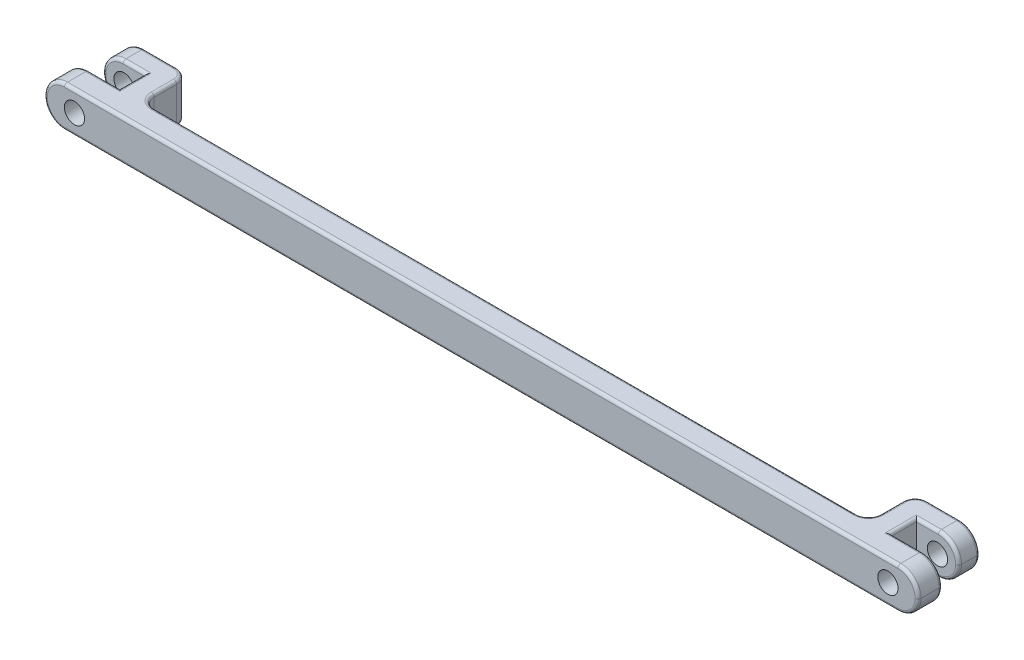
from build123d import *

# Parameters (mm, degrees)
BOSS_EXTRUDE1_DEPTH = 67
CUT_EXTRUDE2_REACH  = 737.464
SKETCH3_R           = 16.75
RADYUS1_R           = 20
RADYUS2_R           = 33.5
RADYUS4_R           = 5


with BuildPart() as part:
    # Sketch2 → Boss-Extrude1 (new body)
    with BuildSketch(Plane(origin=(0, 0, 0), x_dir=(1, 0, 0), z_dir=(0, 1, 0))):
        Polygon((-723, 40), (-723, 0), (0, 0), (0, 40), (-601, 40), (-601, 117), (-708, 117), (-708, 82), (-638, 82), (-638, 40), align=None)
        Polygon((0, 40), (0, 0), (723, 0), (723, 40), (638, 40), (638, 82), (708, 82), (708, 117), (601, 117), (601, 40), align=None)
    extrude(amount=BOSS_EXTRUDE1_DEPTH)

    # Cut-Extrude2: up to this face of the body (flat: up to its plane)
    cut_extrude2_end = Plane(part.part.faces().sort_by_distance((0, 33.5, 0))[0])
    # Sketch3 → Cut-Extrude2 (cut, up to the picked face)
    with BuildSketch(Plane(origin=(0, 0, -117), x_dir=(-1, 0, 0), z_dir=(0, 0, -1)), mode=Mode.PRIVATE) as cut_extrude2_sk1:
        with Locations((-673, 33.5)):
            Circle(SKETCH3_R)
    cut_extrude2_tool1 = split(extrude(cut_extrude2_sk1.sketch, amount=-CUT_EXTRUDE2_REACH, mode=Mode.PRIVATE), bisect_by=cut_extrude2_end, keep=Keep.BOTH, mode=Mode.PRIVATE)
    # Sketch3 → Cut-Extrude2 (cut, up to the picked face)
    with BuildSketch(Plane(origin=(0, 0, -117), x_dir=(-1, 0, 0), z_dir=(0, 0, -1)), mode=Mode.PRIVATE) as cut_extrude2_sk2:
        with Locations((673, 33.5)):
            Circle(SKETCH3_R)
    cut_extrude2_tool2 = split(extrude(cut_extrude2_sk2.sketch, amount=-CUT_EXTRUDE2_REACH, mode=Mode.PRIVATE), bisect_by=cut_extrude2_end, keep=Keep.BOTH, mode=Mode.PRIVATE)
    add(cut_extrude2_tool1.solids().sort_by(Axis((673, 33.5, -117), (0, 0, 1)))[0], mode=Mode.SUBTRACT)
    add(cut_extrude2_tool2.solids().sort_by(Axis((-673, 33.5, -117), (0, 0, 1)))[0], mode=Mode.SUBTRACT)

    # Radyus1
    radyus1_edges = [part.edges().sort_by_distance(p)[0] for p in [
        (-601, 33.5, -117),
        (-601, 33.5, -40),
        (601, 33.5, -40),
        (601, 33.5, -117),
    ]]
    fillet(radyus1_edges, radius=RADYUS1_R)

    # Radyus2
    radyus2_edges = [part.edges().sort_by_distance(p)[0] for p in [
        (-723, 0, -20),
        (-723, 67, -20),
        (723, 0, -20),
        (723, 67, -20),
        (708, 67, -99.5),
        (708, 0, -99.5),
        (-708, 0, -99.5),
        (-708, 67, -99.5),
    ]]
    fillet(radyus2_edges, radius=RADYUS2_R - 0.0001)  # a hair under: the kernel refuses the full size

    # Radyus4
    radyus4_edges = [part.edges().sort_by_distance(p)[0] for p in [
        (647.75005, 67, -117),
        (-647.75005, 67, -117),
        (663.75005, 67, -40),
        (713.188106459, 57.188106459, -40),
        (713.188106459, 9.811893541, -40),
        (698.188106459, 9.811893541, -117),
        (698.188106459, 57.188106459, -117),
        (698.188106459, 9.811893541, -82),
        (698.188106459, 57.188106459, -82),
        (-698.188106459, 57.188106459, -117),
        (-698.188106459, 9.811893541, -117),
        (-698.188106459, 57.188106459, -82),
        (-698.188106459, 9.811893541, -82),
        (-656.25005, 0, -82),
        (638, 67, -61),
        (656.25005, 0, -82),
        (656.25005, 67, -82),
        (-656.25005, 67, -82),
        (-638, 67, -61),
        (601, 0, -78.5),
        (601, 67, -78.5),
        (-601, 0, -78.5),
        (0, 0, -40),
        (-606.857864376, 0, -111.142135624),
        (606.857864376, 0, -111.142135624),
        (0, 67, -40),
        (-601, 67, -78.5),
        (-606.857864376, 67, -111.142135624),
        (606.857864376, 67, -111.142135624),
        (595.142135624, 0, -45.857864376),
        (595.142135624, 67, -45.857864376),
        (-595.142135624, 0, -45.857864376),
        (-595.142135624, 67, -45.857864376),
        (647.75005, 0, -117),
        (663.75005, 0, -40),
        (0, 0, 0),
        (-663.75005, 0, -40),
        (-647.75005, 0, -117),
        (-663.75005, 67, -40),
        (-713.188106459, 57.188106459, -40),
        (-713.188106459, 9.811893541, -40),
        (0, 67, 0),
        (713.188106459, 57.188106459, 0),
        (713.188106459, 9.811893541, 0),
        (-713.188106459, 57.188106459, 0),
        (-713.188106459, 9.811893541, 0),
    ]]
    fillet(radyus4_edges, radius=RADYUS4_R)


solid = part.part
